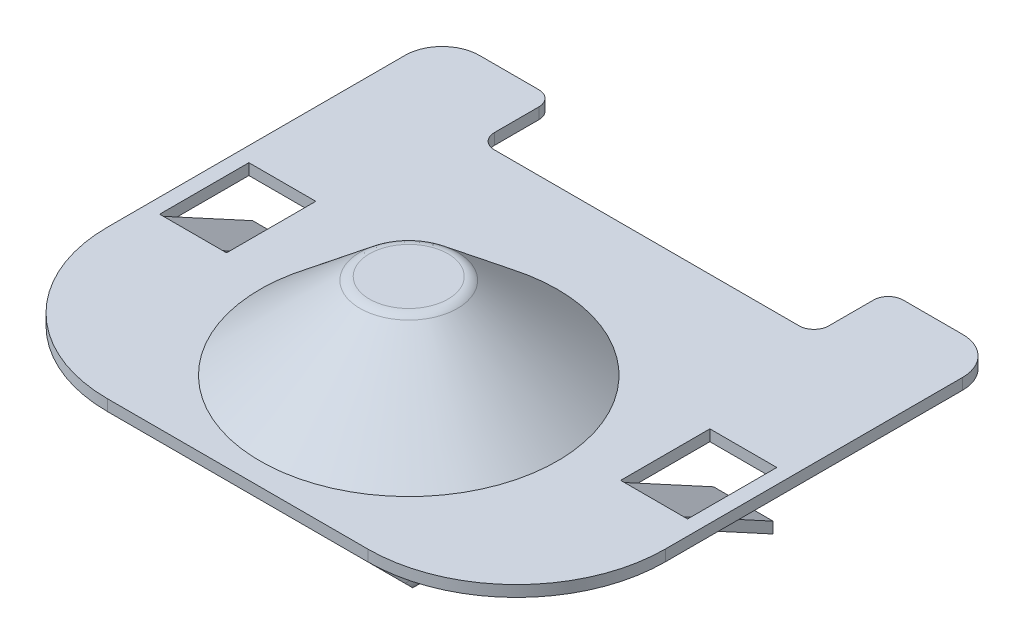
from build123d import *

# Parameters (mm, degrees)
SKETCH1_W               = 15
SKETCH1_H               = 13
BASE_DEPTH              = 0.3
SKETCH2_R               = 4
PT_CUT_DEPTH            = 10.92924972
WIRE_CONNECTION_DEPTH   = 1
SKETCH7_W               = 1.8
SKETCH7_H               = 2.4
LOCKING_CLAMP_CUT_DEPTH = 11.816191566
LOCKING_CLAMP_DEPTH     = 0.8
SKETCH9_W               = 9
SKETCH9_H               = 2
BOTTOM_SLOT_CUT_DEPTH   = 11.816191566
TS_F_R                  = 1
BS_F_R                  = 4
WC_F_R                  = 0.5
BSC_F_R                 = 0.4


with BuildPart() as part:
    # Sketch1 → BASE (new body)
    with BuildSketch(Plane(origin=(0, 0, 0), x_dir=(1, 0, 0), z_dir=(0, 1, 0))):
        Rectangle(SKETCH1_W, SKETCH1_H)
    extrude(amount=BASE_DEPTH)

    # Sketch2 → PT CUT (cut, through all)
    with BuildSketch(Plane(origin=(0, 0.3, 0), x_dir=(1, 0, 0), z_dir=(0, 1, 0))):
        with Locations(Location((0, -1.9, 0), (0, 0, 270))):
            Circle(SKETCH2_R)
    extrude(amount=-PT_CUT_DEPTH, mode=Mode.SUBTRACT)

    # Sketch4 → POSITIVE TERMINAL (revolve)
    with BuildSketch(Plane.XY.offset(1.9), mode=Mode.PRIVATE) as positive_terminal_sk:
        with BuildLine():
            Line((0, 2.6), (1.056776663, 2.6))
            ThreePointArc((1.056776663, 2.6), (1.191616938, 2.576587441), (1.310672433, 2.509090502))
            Line((1.310672433, 2.509090502), (4, 0.3))
            Line((4, 0.3), (4, 0))
            Line((4, 0), (3.7, 0))
            ThreePointArc((3.7, 0), (3.629289322, 0.029289322), (3.6, 0.1))
            Line((3.6, 0.1), (3.6, 0.252730922))
            ThreePointArc((3.6, 0.252730922), (3.590408501, 0.295466187), (3.563473942, 0.330003547))
            Line((3.563473942, 0.330003547), (1.220553608, 2.254545251))
            ThreePointArc((1.220553608, 2.254545251), (1.16102586, 2.28829372), (1.093605723, 2.3))
            Line((1.093605723, 2.3), (0, 2.3))
            Line((0, 2.3), (0, 2.6))
        make_face()
    revolve(positive_terminal_sk.sketch.rotate(Axis((0, 0, 1.9), (0, 1, 0)), 90), axis=Axis((0, 0, 1.9), (0, 1, 0)))

    # Sketch5 → WIRE CONNECTION (add, symmetric)
    with BuildSketch(Plane(origin=(0, 0, 0), x_dir=(0, 0, -1), z_dir=(1, 0, 0))):
        Polygon((-6.5, 0), (-2.5, -4), (-2.2, -4), (-6.2, 0), align=None)
    extrude(amount=WIRE_CONNECTION_DEPTH, both=True)

    # Sketch7 → LOCKING CLAMP CUT (cut, through all)
    with BuildSketch(Plane(origin=(0, 0.3, 0), x_dir=(1, 0, 0), z_dir=(0, 1, 0))):
        with Locations((6.2, -0.3)):
            Rectangle(SKETCH7_W, SKETCH7_H)
    locking_clamp_cut = extrude(amount=-LOCKING_CLAMP_CUT_DEPTH, mode=Mode.SUBTRACT)

    # Sketch8 → LOCKING CLAMP (add, symmetric)
    with BuildSketch(Plane(origin=(6.2, 0, 0), x_dir=(0, 0, -1), z_dir=(1, 0, 0))):
        Polygon((0.9, -1), (-1.5, 0.3), (-1.5, 0), (0.9, -1.3), align=None)
    locking_clamp = extrude(amount=LOCKING_CLAMP_DEPTH, both=True)

    # LC M: LOCKING CLAMP CUT, LOCKING CLAMP across plane
    add(locking_clamp_cut.mirror(Plane(origin=(0, 0, 0), x_dir=(0, 0, 1), z_dir=(1, 0, 0))), mode=Mode.SUBTRACT)
    add(locking_clamp.mirror(Plane(origin=(0, 0, 0), x_dir=(0, 0, 1), z_dir=(1, 0, 0))))

    # Sketch9 → BOTTOM SLOT CUT (cut, through all)
    with BuildSketch(Plane(origin=(0, 0.3, 0), x_dir=(1, 0, 0), z_dir=(0, 1, 0))):
        with Locations((0, 5.5)):
            Rectangle(SKETCH9_W, SKETCH9_H)
    extrude(amount=-BOTTOM_SLOT_CUT_DEPTH, mode=Mode.SUBTRACT)

    # TS F
    ts_f_edges = [part.edges().sort_by_distance(p)[0] for p in [
        (-7.5, 0.15, -6.5),
        (7.5, 0.15, -6.5),
    ]]
    fillet(ts_f_edges, radius=TS_F_R)

    # BS F
    bs_f_edges = [part.edges().sort_by_distance(p)[0] for p in [
        (7.5, 0.15, 6.5),
        (-7.5, 0.15, 6.5),
    ]]
    fillet(bs_f_edges, radius=BS_F_R)

    # WC F
    # the kernel refuses this fillet: 0.5 mm, written as the material it takes off along each edge
    with BuildSketch(Plane(origin=(-1, -4, 3.75), x_dir=(0, 1, 0), z_dir=(0, 0, -1))) as wc_f_piece_1:
        with BuildLine():
            CenterArc((WC_F_R, WC_F_R), WC_F_R, 180, 90)
            Line((0, WC_F_R), (0, 0))
            Line((0, 0), (WC_F_R, 0))
        make_face()
    extrude(amount=2.8, mode=Mode.SUBTRACT)
    with BuildSketch(Plane(origin=(1, -4, 3.75), x_dir=(0, 1, 0), z_dir=(0, 0, -1))) as wc_f_piece_2:
        with BuildLine():
            CenterArc((WC_F_R, -WC_F_R), WC_F_R, 90, 90)
            Line((0, -WC_F_R), (0, 0))
            Line((0, 0), (WC_F_R, 0))
        make_face()
    extrude(amount=2.8, mode=Mode.SUBTRACT)

    # BSC F
    bsc_f_edges = [part.edges().sort_by_distance(p)[0] for p in [
        (-4.5, 0.15, -6.5),
        (4.5, 0.15, -6.5),
        (4.5, 0.15, -4.5),
        (-4.5, 0.15, -4.5),
    ]]
    fillet(bsc_f_edges, radius=BSC_F_R)


solid = part.part
